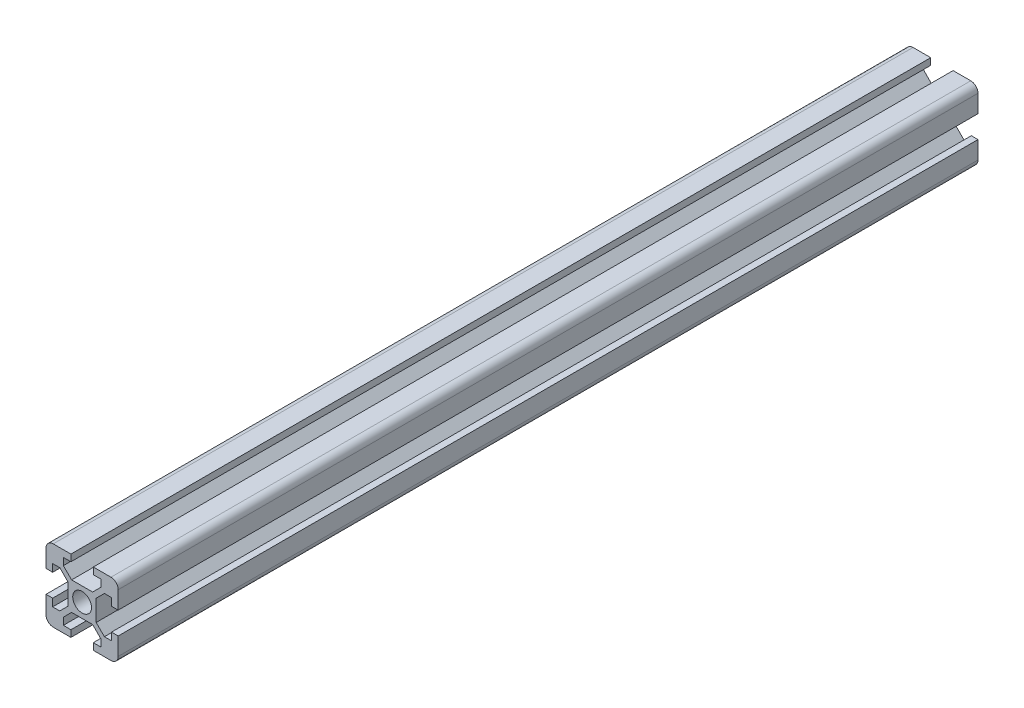
from build123d import *

# Parameters (mm, degrees)
SKETCH1_R           = 2.6
BOSS_EXTRUDE1_DEPTH = 238.2020001
FILLET1_R           = 2


with BuildPart() as part:
    # Sketch1 → Boss-Extrude1 (new body)
    with BuildSketch(Plane.XY):
        Polygon((-3.9, 2.910050506), (-6.179949494, 5.19), (-8.15, 5.19), (-8.15, 3.1), (-10, 3.1), (-10, 10), (-3.1, 10), (-3.1, 8.15), (-5.19, 8.15), (-5.19, 6.179949494), (-2.910050506, 3.9), (2.910050506, 3.9), (5.19, 6.179949494), (5.19, 8.15), (3.1, 8.15), (3.1, 10), (10, 10), (10, 3.1), (8.15, 3.1), (8.15, 5.19), (6.179949494, 5.19), (3.9, 2.910050506), (3.9, -2.910050506), (6.179949494, -5.19), (8.15, -5.19), (8.15, -3.1), (10, -3.1), (10, -10), (3.1, -10), (3.1, -8.15), (5.19, -8.15), (5.19, -6.179949494), (2.910050506, -3.9), (-2.910050506, -3.9), (-5.19, -6.179949494), (-5.19, -8.15), (-3.1, -8.15), (-3.1, -10), (-10, -10), (-10, -3.1), (-8.15, -3.1), (-8.15, -5.19), (-6.179949494, -5.19), (-3.9, -2.910050506), align=None)
        Circle(SKETCH1_R, mode=Mode.SUBTRACT)
    extrude(amount=-BOSS_EXTRUDE1_DEPTH)

    # Fillet1
    fillet1_edges = [part.edges().sort_by_distance(p)[0] for p in [
        (10, -10, -119.10100005),
        (-10, -10, -119.10100005),
        (10, 10, -119.10100005),
        (-10, 10, -119.10100005),
    ]]
    fillet(fillet1_edges, radius=FILLET1_R)


solid = part.part
